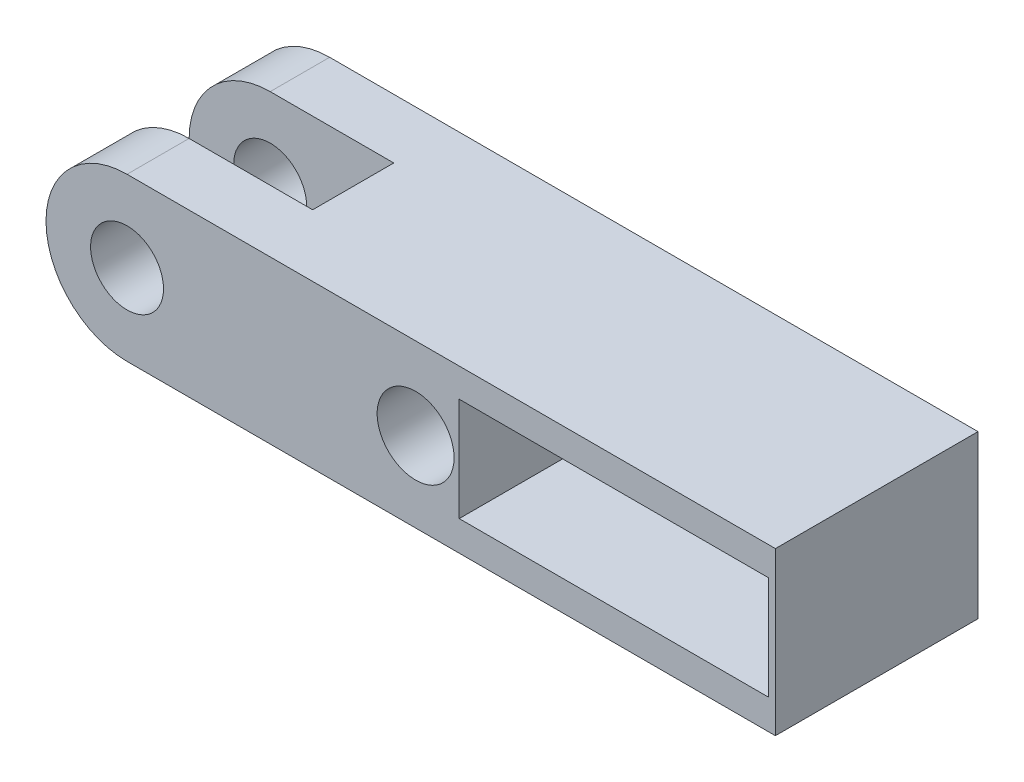
from build123d import *

# Parameters (mm, degrees)
SKETCH1_R           = 2.25
SKETCH1_R_2         = 2.37266458
SKETCH1_W           = 19.08
SKETCH1_H           = 6.38
BOSS_EXTRUDE1_DEPTH = 6.25
SKETCH13_W          = 12.867541265
SKETCH13_H          = 5.004043825
CUT_EXTRUDE1_DEPTH  = 10
CHAMFER1_SIZE       = 10


with BuildPart() as part:
    # Sketch1 → Boss-Extrude1 (new, symmetric)
    with BuildSketch(Plane.XY):
        with BuildLine():
            Line((0, 5), (40, 5))
            Line((40, 5), (40, -5))
            Line((40, -5), (0, -5))
            ThreePointArc((0, -5), (-5, 0), (0, 5))
        make_face()
        Circle(SKETCH1_R, mode=Mode.SUBTRACT)
        with Locations((17.802904034, -0.066795827)):
            Circle(SKETCH1_R_2, mode=Mode.SUBTRACT)
        with Locations((30.033910385, 0.039223356)):
            Rectangle(SKETCH1_W, SKETCH1_H, mode=Mode.SUBTRACT)
    extrude(amount=BOSS_EXTRUDE1_DEPTH, both=True)

    # Sketch13 → Cut-Extrude1 (cut)
    with BuildSketch(Plane.XZ.offset(5)):
        with Locations((1.190063179, -0.07942928)):
            Rectangle(SKETCH13_W, SKETCH13_H)
    extrude(amount=-CUT_EXTRUDE1_DEPTH, mode=Mode.SUBTRACT)

    # Chamfer1
    chamfer1_edges = [part.edges().sort_by_distance(p)[0] for p in [
        (7.623833811, -5, -0.07942928),
    ]]
    chamfer(chamfer1_edges, length=CHAMFER1_SIZE - 0.0001)  # a hair under: the kernel refuses the full size


solid = part.part
